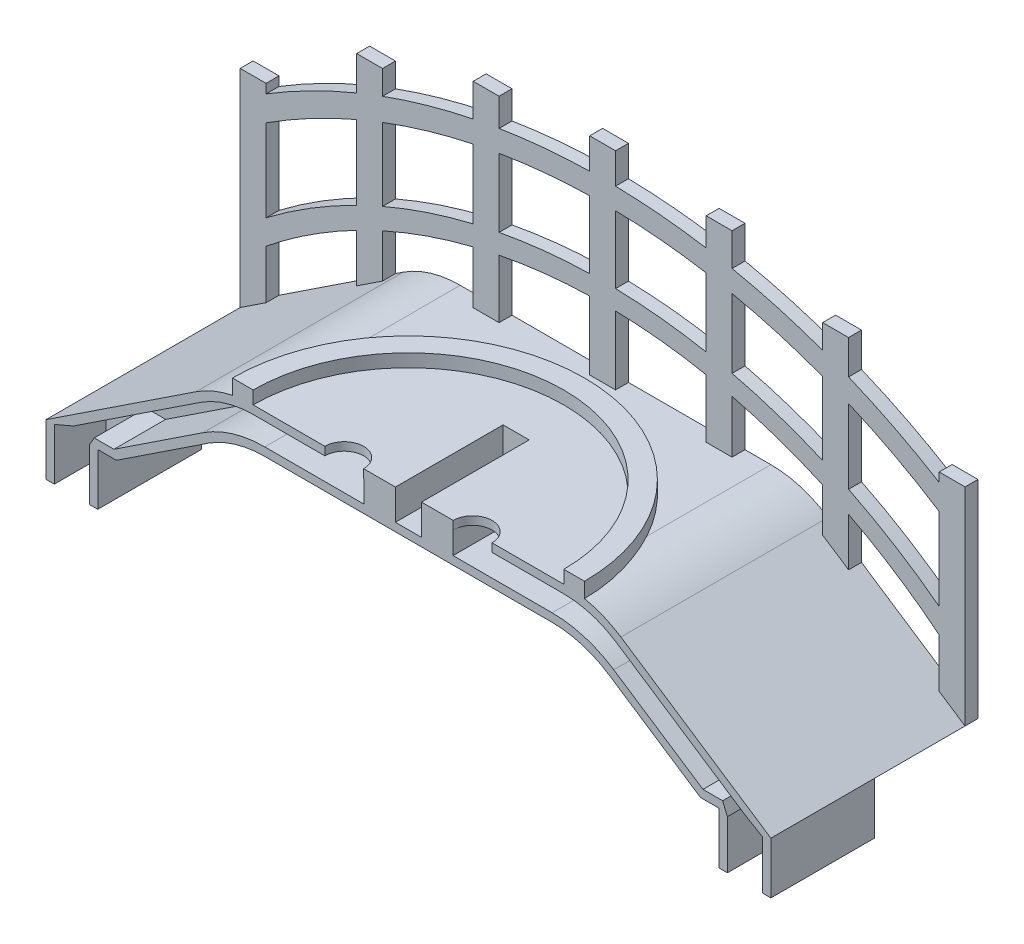
from build123d import *

# Parameters (mm, degrees)
BOSS_EXTRUDE1_DEPTH      = 12.7
BOSS_EXTRUDE2_DEPTH      = 0.79375
SKETCH5_7_W              = 1.5875
SKETCH5_7_H              = 15.875
SKETCH5_7_H_2            = 12.7
BOSS_EXTRUDE6_DEPTH      = 0.79375
BOSS_EXTRUDE7_DEPTH      = 0.79375
CUT_EXTRUDE1_DEPTH       = 9.525
SKETCH8_W                = 1.6002
SKETCH8_H                = 6.604
CUT_EXTRUDE2_DEPTH       = 1.397
BOSS_EXTRUDE8_DEPTH      = 1.397
BOSS_EXTRUDE9_DEPTH      = 0.79375
BOSS_EXTRUDE9_DEPTH_BACK = 0.254
SKETCH12_W               = 3.175
SKETCH12_H               = 6.35
BOSS_EXTRUDE10_DEPTH     = 3.175
CUT_EXTRUDE3_DEPTH       = 3.175
CUT_EXTRUDE4_DEPTH       = 3.175


with BuildPart() as part:
    # Sketch5 → Boss-Extrude1 (new body)
    with BuildSketch(Plane.XY):
        with BuildLine():
            Line((4.317823407, 0), (9.914002503, 3.699748883))
            ThreePointArc((9.914002503, 3.699748883), (11.587555655, 4.483774401), (13.415983959, 4.752709532))
            Line((13.415983959, 4.752709532), (31.034016041, 4.752709532))
            ThreePointArc((31.034016041, 4.752709532), (32.862444345, 4.483774401), (34.535997497, 3.699748883))
            Line((34.535997497, 3.699748883), (40.132176593, 0))
            Line((40.132176593, 0), (44.45, 0))
            Line((44.45, 0), (35.251981456, 6.080998883))
            ThreePointArc((35.251981456, 6.080998883), (33.578428304, 6.865024401), (31.75, 7.133959532))
            Line((31.75, 7.133959532), (12.7, 7.133959532))
            ThreePointArc((12.7, 7.133959532), (10.871571696, 6.865024401), (9.198018544, 6.080998883))
            Line((9.198018544, 6.080998883), (0, 0))
            Line((0, 0), (4.317823407, 0))
        make_face()
    extrude(amount=BOSS_EXTRUDE1_DEPTH)



with BuildPart() as body_2:
    # Sketch5<4> → Boss-Extrude2 (new body)
    with BuildSketch(Plane.XY):
        with BuildLine():
            Line((44.45, 9.525), (44.45, 11.1125))
            ThreePointArc((44.45, 11.1125), (22.225, 17.96069625), (0, 11.1125))
            Line((0, 11.1125), (0, 9.525))
            ThreePointArc((0, 9.525), (22.225, 16.658959532), (44.45, 9.525))
        make_face()
    extrude(amount=BOSS_EXTRUDE2_DEPTH)

    # Sketch5<7> → Boss-Extrude6 (add)
    with BuildSketch(Plane.XY):
        with Locations((7.9375, 9.122908395)):
            Rectangle(SKETCH5_7_W, SKETCH5_7_H)
        Polygon((0, 0), (1.5875, 1.049528839), (1.5875, 12.7), (0, 12.7), align=None)
        with Locations((15.08125, 11.222301738)):
            Rectangle(SKETCH5_7_W, SKETCH5_7_H)
        with Locations((22.225, 11.896459532)):
            Rectangle(SKETCH5_7_W, SKETCH5_7_H)
        with BuildLine():
            Line((28.575, 3.284801738), (30.1625, 3.284801738))
            Line((30.1625, 3.284801738), (30.1625, 15.824904204))
            ThreePointArc((30.1625, 15.824904204), (29.370349797, 15.984497043), (28.575, 16.127292418))
            Line((28.575, 16.127292418), (28.575, 3.284801738))
        make_face()
        with BuildLine():
            Line((28.575, 19.159801738), (28.575, 17.446790716))
            ThreePointArc((28.575, 17.446790716), (29.370242514, 17.308866955), (30.1625, 17.154718663))
            Line((30.1625, 17.154718663), (30.1625, 19.159801738))
            Line((30.1625, 19.159801738), (28.575, 19.159801738))
        make_face()
        with Locations((36.5125, 9.122908395)):
            Rectangle(SKETCH5_7_W, SKETCH5_7_H)
        with Locations((43.65625, 6.35)):
            Rectangle(SKETCH5_7_W, SKETCH5_7_H_2)
    extrude(amount=BOSS_EXTRUDE6_DEPTH)


with BuildPart() as part_1:
    add(part.part)

    add(body_2.part)  # Boss-Extrude7 merges body 2
    # Sketch6 → Boss-Extrude7 (add)
    with BuildSketch(Plane(origin=(0, 0, 0), x_dir=(-1, 0, 0), z_dir=(0, 0, -1))):
        with BuildLine():
            Line((-44.45, 4.270423014), (-44.45, 2.682923014))
            ThreePointArc((-44.45, 2.682923014), (-22.225, 11.337252313), (0, 2.682923014))
            Line((0, 2.682923014), (0, 4.270423014))
            ThreePointArc((0, 4.270423014), (-22.225, 12.523643082), (-44.45, 4.270423014))
        make_face()
    extrude(amount=-BOSS_EXTRUDE7_DEPTH)

    # Sketch7 → Cut-Extrude1 (cut)
    with BuildSketch(Plane.XY.offset(12.7)):
        Polygon((31.75, 6.625959532), (12.7, 6.625959532), (12.7, 5.260709532), (13.415983959, 5.260709532), (31.034016041, 5.260709532), (31.75, 5.260709532), align=None)
    extrude(amount=-CUT_EXTRUDE1_DEPTH, mode=Mode.SUBTRACT)

    # Sketch8 → Cut-Extrude2 (cut)
    with BuildSketch(Plane(origin=(0, 7.133959532, 0), x_dir=(1, 0, 0), z_dir=(0, 1, 0))):
        with BuildLine():
            Line((17.097375, -12.7), (19.478625, -12.7))
            ThreePointArc((19.478625, -12.7), (18.288, -11.509375), (17.097375, -12.7))
        make_face()
        with BuildLine():
            ThreePointArc((27.352625, -12.7), (26.162, -11.509375), (24.971375, -12.7))
            Line((24.971375, -12.7), (27.352625, -12.7))
        make_face()
        with Locations((22.225, -9.398)):
            Rectangle(SKETCH8_W, SKETCH8_H)
    extrude(amount=-CUT_EXTRUDE2_DEPTH, mode=Mode.SUBTRACT)

    # Sketch10 → Boss-Extrude8 (add)
    with BuildSketch(Plane(origin=(0, 5.260709532, 0), x_dir=(1, 0, 0), z_dir=(0, 1, 0))):
        Polygon((19.488784942, -5.496745829), (19.488784942, -12.7), (21.4249, -12.7), (21.4249, -6.096), (23.0251, -6.096), (23.0251, -12.7), (24.961215058, -12.7), (24.961215058, -5.496745829), align=None)
    extrude(amount=BOSS_EXTRUDE8_DEPTH)

    # Sketch11 → Boss-Extrude9 (add, two sides: drawn at the far end of the back side and taken through both)
    with BuildSketch(Plane(origin=(0, 7.133959532, 0), x_dir=(1, 0, 0), z_dir=(0, 1, 0)).offset(-BOSS_EXTRUDE9_DEPTH_BACK)):
        with BuildLine():
            Line((11.43, -12.7), (12.7, -12.7))
            ThreePointArc((12.7, -12.7), (22.225, -3.175), (31.75, -12.7))
            Line((31.75, -12.7), (33.02, -12.7))
            ThreePointArc((33.02, -12.7), (22.225, -1.905), (11.43, -12.7))
        make_face()
    extrude(amount=BOSS_EXTRUDE9_DEPTH + BOSS_EXTRUDE9_DEPTH_BACK)

    # Sketch12 → Boss-Extrude10 (add)
    with BuildSketch(Plane.XZ):
        with Locations((1.5875, 9.525)):
            Rectangle(SKETCH12_W, SKETCH12_H)
        with Locations((42.8625, 9.525)):
            Rectangle(SKETCH12_W, SKETCH12_H)
    extrude(amount=BOSS_EXTRUDE10_DEPTH)

    # Sketch7<4> → Cut-Extrude3 (cut)
    with BuildSketch(Plane.XY.offset(12.7)):
        with BuildLine():
            Line((12.7, 5.260709532), (12.7, 6.625959532))
            ThreePointArc((12.7, 6.625959532), (11.017845961, 6.378539211), (9.478177061, 5.657235735))
            Line((9.478177061, 5.657235735), (1.689528076, 0.508))
            Line((1.689528076, 0.508), (4.165080162, 0.508))
            Line((4.165080162, 0.508), (9.633843986, 4.123512031))
            ThreePointArc((9.633843986, 4.123512031), (11.441281391, 4.97025959), (13.415983959, 5.260709532))
            Line((13.415983959, 5.260709532), (12.7, 5.260709532))
        make_face()
        with BuildLine():
            ThreePointArc((34.971822939, 5.657235735), (33.432154039, 6.378539211), (31.75, 6.625959532))
            Line((31.75, 6.625959532), (31.75, 5.260709532))
            Line((31.75, 5.260709532), (31.034016041, 5.260709532))
            ThreePointArc((31.034016041, 5.260709532), (33.008718609, 4.97025959), (34.816156014, 4.123512031))
            Line((34.816156014, 4.123512031), (40.284919838, 0.508))
            Line((40.284919838, 0.508), (42.760471924, 0.508))
            Line((42.760471924, 0.508), (34.971822939, 5.657235735))
        make_face()
    extrude(amount=-CUT_EXTRUDE3_DEPTH, mode=Mode.SUBTRACT)

    # Sketch15 → Cut-Extrude4 (cut)
    with BuildSketch(Plane.XY.offset(12.7)):
        Polygon((1.689528076, 0.508), (0.508, 0), (0.508, -3.175), (2.667, -3.175), (2.667, 0), (2.959528076, 0.508), align=None)
        Polygon((42.760471924, 0.508), (43.942, -0.194342167), (43.942, -3.175), (41.783, -3.175), (41.783, -0.194342167), (41.490471924, 0.508), align=None)
    extrude(amount=-CUT_EXTRUDE4_DEPTH, mode=Mode.SUBTRACT)


solid = part_1.part
